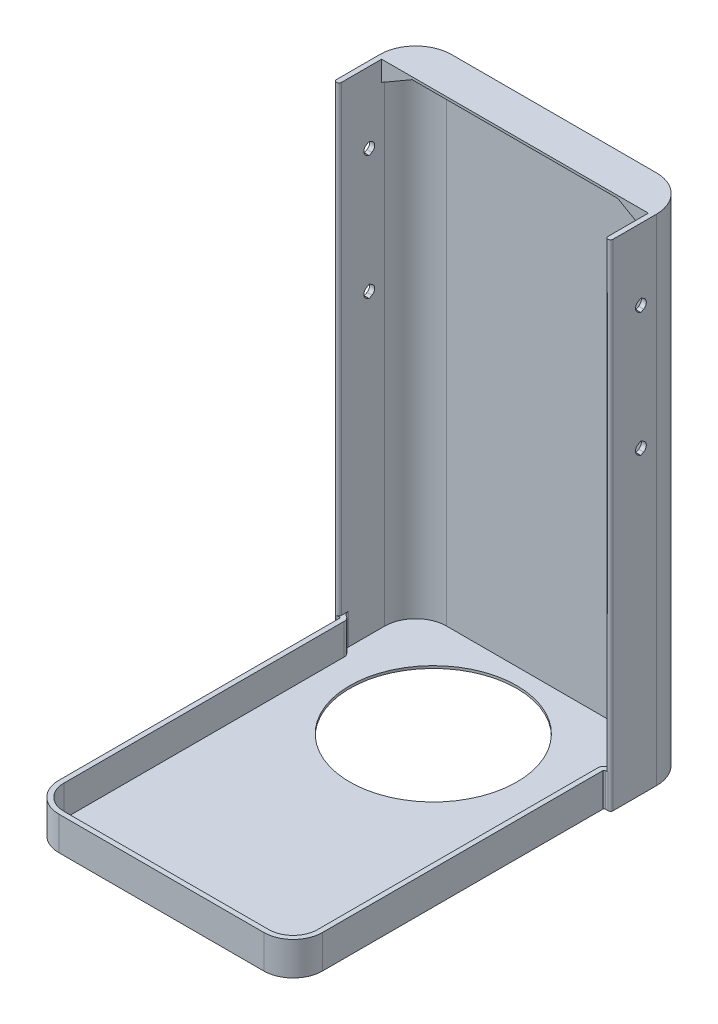
from build123d import *
from OCP.BRepFilletAPI import BRepFilletAPI_MakeChamfer

# Parameters (mm, degrees)
BOSS_EXTRUDE1_DEPTH = 160
BOSS_EXTRUDE2_START = -0.8
BOSS_EXTRUDE2_DEPTH = 0.8
CUT_EXTRUDE1_DEPTH  = 185.952426316
SKETCH4_R           = 27
BOSS_EXTRUDE3_DEPTH = 0.8
FILLET1_R           = 0.4
BOSS_EXTRUDE4_DEPTH = 10
FILLET2_R           = 2
CHAMFER1_SIZE       = 5.7
CHAMFER1_SIZE2      = 9.872689603


with BuildPart() as part:
    # Sketch1 → Boss-Extrude1 (new body)
    with BuildSketch(Plane(origin=(0, 0, 0), x_dir=(1, 0, 0), z_dir=(0, 1, 0))):
        with BuildLine():
            Line((-33.1, 0), (33.1, 0))
            ThreePointArc((33.1, 0), (40.171067812, -2.928932188), (43.1, -10))
            Line((43.1, -10), (43.1, -24))
            ThreePointArc((43.1, -24), (43.9, -24.8), (44.7, -24))
            Line((44.7, -24), (44.7, -10))
            ThreePointArc((44.7, -10), (41.302438662, -1.797561338), (33.1, 1.6))
            Line((33.1, 1.6), (-33.1, 1.6))
            ThreePointArc((-33.1, 1.6), (-41.302438662, -1.797561338), (-44.7, -10))
            Line((-44.7, -10), (-44.7, -24))
            ThreePointArc((-44.7, -24), (-43.9, -24.8), (-43.1, -24))
            Line((-43.1, -24), (-43.1, -10))
            ThreePointArc((-43.1, -10), (-40.171067812, -2.928932188), (-33.1, 0))
        make_face()
    extrude(amount=BOSS_EXTRUDE1_DEPTH)

    # Sketch2 → Boss-Extrude2 (add)
    with BuildSketch(Plane(origin=(0, 160, 0), x_dir=(1, 0, 0), z_dir=(0, 1, 0)).offset(BOSS_EXTRUDE2_START)):
        with BuildLine():
            Line((44.7, -10), (44.7, -11))
            Line((44.7, -11), (-44.7, -11))
            Line((-44.7, -11), (-44.7, -10))
            ThreePointArc((-44.7, -10), (-41.302438662, -1.797561338), (-33.1, 1.6))
            Line((-33.1, 1.6), (33.1, 1.6))
            ThreePointArc((33.1, 1.6), (41.302438662, -1.797561338), (44.7, -10))
        make_face()
    extrude(amount=BOSS_EXTRUDE2_DEPTH)

    # Sketch3 → Cut-Extrude1 (cut, through all)
    with BuildSketch(Plane(origin=(44.7, 0, 0), x_dir=(0, 0, -1), z_dir=(1, 0, 0))):
        with BuildLine():
            Line((-15.875, 138.515544457), (-15, 139.020725942))
            Line((-15, 139.020725942), (-14.125, 138.515544457))
            ThreePointArc((-14.125, 138.515544457), (-13.25, 137), (-14.125, 135.484455543))
            Line((-14.125, 135.484455543), (-15, 134.979274058))
            Line((-15, 134.979274058), (-15.875, 135.484455543))
            ThreePointArc((-15.875, 135.484455543), (-16.75, 137), (-15.875, 138.515544457))
        make_face()
        with BuildLine():
            Line((-15.875, 98.515544457), (-15, 99.020725942))
            Line((-15, 99.020725942), (-14.125, 98.515544457))
            ThreePointArc((-14.125, 98.515544457), (-13.25, 97), (-14.125, 95.484455543))
            Line((-14.125, 95.484455543), (-15, 94.979274058))
            Line((-15, 94.979274058), (-15.875, 95.484455543))
            ThreePointArc((-15.875, 95.484455543), (-16.75, 97), (-15.875, 98.515544457))
        make_face()
    extrude(amount=-CUT_EXTRUDE1_DEPTH, mode=Mode.SUBTRACT)

    # Sketch4 → Boss-Extrude3 (add)
    with BuildSketch(Plane.XZ):
        with BuildLine():
            Line((-43.9, 24.8), (-42.6, 24.8))
            Line((-42.6, 24.8), (-42.6, 115.8))
            ThreePointArc((-42.6, 115.8), (-39.817514421, 122.517514421), (-33.1, 125.3))
            Line((-33.1, 125.3), (33.1, 125.3))
            ThreePointArc((33.1, 125.3), (39.817514421, 122.517514421), (42.6, 115.8))
            Line((42.6, 115.8), (42.6, 24.8))
            Line((42.6, 24.8), (43.9, 24.8))
            ThreePointArc((43.9, 24.8), (43.334314575, 24.565685425), (43.1, 24))
            Line((43.1, 24), (43.1, 10))
            ThreePointArc((43.1, 10), (40.171067812, 2.928932188), (33.1, 0))
            Line((33.1, 0), (-33.1, 0))
            ThreePointArc((-33.1, 0), (-40.171067812, 2.928932188), (-43.1, 10))
            Line((-43.1, 10), (-43.1, 24))
            ThreePointArc((-43.1, 24), (-43.334314575, 24.565685425), (-43.9, 24.8))
        make_face()
        with Locations(Location((-5.1, 32.3, 0), (0, 0, 270))):
            Circle(SKETCH4_R, mode=Mode.SUBTRACT)
    extrude(amount=-BOSS_EXTRUDE3_DEPTH)

    # Fillet1
    fillet1_edges = [part.edges().sort_by_distance(p)[0] for p in [
        (-42.6, 0.4, 24.8),
        (42.6, 0.4, 24.8),
    ]]
    fillet(fillet1_edges, radius=FILLET1_R)

    # Sketch6 → Boss-Extrude4 (add)
    with BuildSketch(Plane(origin=(0, 0.8, 0), x_dir=(1, 0, 0), z_dir=(0, 1, 0))):
        with BuildLine():
            Line((-43.1, -23.2), (-43, -23.2))
            ThreePointArc((-43, -23.2), (-41.585786438, -23.785786438), (-41, -25.2))
            Line((-41, -25.2), (-41, -115.8))
            ThreePointArc((-41, -115.8), (-38.686143571, -121.386143571), (-33.1, -123.7))
            Line((-33.1, -123.7), (33.1, -123.7))
            ThreePointArc((33.1, -123.7), (38.686143571, -121.386143571), (41, -115.8))
            Line((41, -115.8), (41, -25.2))
            ThreePointArc((41, -25.2), (41.585786438, -23.785786438), (43, -23.2))
            Line((43, -23.2), (43.1, -23.2))
            Line((43.1, -23.2), (43.1, -24))
            ThreePointArc((43.1, -24), (43.334314575, -24.565685425), (43.9, -24.8))
            Line((43.9, -24.8), (43, -24.8))
            ThreePointArc((43, -24.8), (42.717157288, -24.917157288), (42.6, -25.2))
            Line((42.6, -25.2), (42.6, -115.8))
            ThreePointArc((42.6, -115.8), (39.817514421, -122.517514421), (33.1, -125.3))
            Line((33.1, -125.3), (-33.1, -125.3))
            ThreePointArc((-33.1, -125.3), (-39.817514421, -122.517514421), (-42.6, -115.8))
            Line((-42.6, -115.8), (-42.6, -25.2))
            ThreePointArc((-42.6, -25.2), (-42.717157288, -24.917157288), (-43, -24.8))
            Line((-43, -24.8), (-43.9, -24.8))
            ThreePointArc((-43.9, -24.8), (-43.334314575, -24.565685425), (-43.1, -24))
            Line((-43.1, -24), (-43.1, -23.2))
        make_face()
    extrude(amount=BOSS_EXTRUDE4_DEPTH)

    # Fillet2
    # the kernel refuses this fillet: 2 mm, written as the material it adds along each edge
    with BuildSketch(Plane(origin=(43.1, 0.8, 23.2), x_dir=(-0.9748527767632401, 0, 0.22284986793130537), z_dir=(0, 1, 0))) as fillet2_piece_1:
        with BuildLine():
            CenterArc((1.610986416, -1.927420567), FILLET2_R, 105.482875224, 61.640649972)
            Line((-0.338719137, -1.481720831), (-0.533689693, -1.437150857))
            Line((-0.533689693, -1.437150857), (-0.194970555, 0.044569974))
            Line((-0.194970555, 0.044569974), (0.044569974, 0.194970555))
            ThreePointArc((0.044569974, 0.194970555), (0.142055251, 0.172685569), (1.023695645, 0.192742057))
            Line((1.023695645, 0.192742057), (1.077085715, 0))
        make_face()
    extrude(amount=10)
    with BuildSketch(Plane(origin=(-43.1, 0.8, 23.2), x_dir=(0.9748527767632457, 0, 0.2228498679312814), z_dir=(0, 1, 0))) as fillet2_piece_2:
        with BuildLine():
            CenterArc((1.610986416, 1.927420567), FILLET2_R, 192.876474804, 61.640649972)
            Line((-0.338719137, 1.481720831), (-0.533689693, 1.437150857))
            Line((-0.533689693, 1.437150857), (-0.194970555, -0.044569974))
            Line((-0.194970555, -0.044569974), (0.044569974, -0.194970555))
            ThreePointArc((0.044569974, -0.194970555), (0.142055251, -0.172685569), (1.023695645, -0.192742057))
            Line((1.023695645, -0.192742057), (1.077085715, 0))
        make_face()
    extrude(amount=10)

    # Chamfer1: one chamfer whose edges measure the first distance from different faces: ONE call of the kernel's chamfer builder (chamfer() names one face for all edges)
    chamfer1_edges_1 = [part.edges().sort_by_distance(p)[0] for p in [
        (0, 159.2, 0),
    ]]
    chamfer1_side_1 = [part.faces().sort_by_distance(p)[0] for p in [
        (0, 80, 0),
    ]]
    chamfer1_edges_2 = [part.edges().sort_by_distance(p)[0] for p in [
        (40.171067812, 159.2, 2.928932188),
    ]]
    chamfer1_side_2 = [part.faces().sort_by_distance(p)[0] for p in [
        (40.171067812, 80, 2.928932188),
    ]]
    chamfer1_edges_3 = [part.edges().sort_by_distance(p)[0] for p in [
        (43.1, 159.2, 10.5),
    ]]
    chamfer1_side_3 = [part.faces().sort_by_distance(p)[0] for p in [
        (43.1, 80.829745828, 16.958586697),
    ]]
    chamfer1_edges_4 = [part.edges().sort_by_distance(p)[0] for p in [
        (-43.1, 159.2, 10.5),
    ]]
    chamfer1_side_4 = [part.faces().sort_by_distance(p)[0] for p in [
        (-43.1, 80.829745828, 16.958586697),
    ]]
    chamfer1_edges_5 = [part.edges().sort_by_distance(p)[0] for p in [
        (-40.171067812, 159.2, 2.928932188),
    ]]
    chamfer1_side_5 = [part.faces().sort_by_distance(p)[0] for p in [
        (-40.171067812, 80, 2.928932188),
    ]]
    chamfer1 = BRepFilletAPI_MakeChamfer(part.part.solid().wrapped)
    for e in chamfer1_edges_1:
        chamfer1.Add(CHAMFER1_SIZE, CHAMFER1_SIZE2, e.wrapped, chamfer1_side_1[0].wrapped)  # the first distance lies on this face
    for e in chamfer1_edges_2:
        chamfer1.Add(CHAMFER1_SIZE, CHAMFER1_SIZE2, e.wrapped, chamfer1_side_2[0].wrapped)  # the first distance lies on this face
    for e in chamfer1_edges_3:
        chamfer1.Add(CHAMFER1_SIZE, CHAMFER1_SIZE2, e.wrapped, chamfer1_side_3[0].wrapped)  # the first distance lies on this face
    for e in chamfer1_edges_4:
        chamfer1.Add(CHAMFER1_SIZE, CHAMFER1_SIZE2, e.wrapped, chamfer1_side_4[0].wrapped)  # the first distance lies on this face
    for e in chamfer1_edges_5:
        chamfer1.Add(CHAMFER1_SIZE, CHAMFER1_SIZE2, e.wrapped, chamfer1_side_5[0].wrapped)  # the first distance lies on this face
    add(Compound.cast(chamfer1.Shape()), mode=Mode.REPLACE)


solid = part.part
